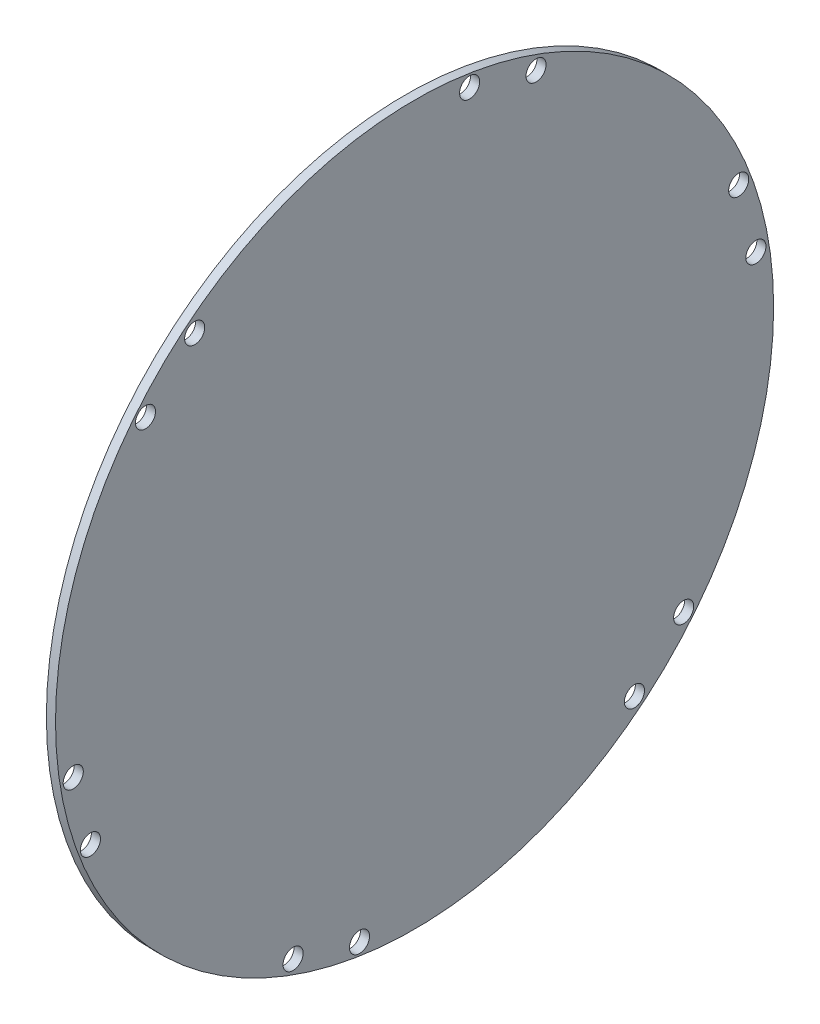
from build123d import *

# Parameters (mm, degrees)
SKETCH2_R           = 125
BOSS_EXTRUDE1_DEPTH = 3.18
SKETCH3_R           = 3.5
CUT_EXTRUDE1_DEPTH  = 177.80529517


with BuildPart() as part:
    # Sketch2 → Boss-Extrude1 (new body)
    with BuildSketch(Plane(origin=(0, 0, 0), x_dir=(0, 0, -1), z_dir=(1, 0, 0))):
        Circle(SKETCH2_R)
    extrude(amount=BOSS_EXTRUDE1_DEPTH)

    # Sketch3 → Cut-Extrude1 (cut, through all)
    with BuildSketch(Plane.ZY):
        with Locations((118.823199541, -19.776442882)):
            Circle(SKETCH3_R)
        with Locations((112.836053622, -43.017658077)):
            Circle(SKETCH3_R)
        with Locations((19.163642105, -119.227717938)):
            Circle(SKETCH3_R)
        with Locations((42.284697838, -112.792130803)):
            Circle(SKETCH3_R)
        with Locations((-76.538501703, -93.015687921)):
            Circle(SKETCH3_R)
        with Locations((-93.672411517, -76.210059861)):
            Circle(SKETCH3_R)
        with Locations((-112.836053622, 43.017658077)):
            Circle(SKETCH3_R)
        with Locations((-118.823199541, 19.776442882)):
            Circle(SKETCH3_R)
        with Locations((-42.284697838, 112.792130802)):
            Circle(SKETCH3_R)
        with Locations((-19.163642105, 119.227717938)):
            Circle(SKETCH3_R)
        with Locations((76.538501703, 93.015687921)):
            Circle(SKETCH3_R)
        with Locations((93.672411517, 76.210059861)):
            Circle(SKETCH3_R)
    extrude(amount=-CUT_EXTRUDE1_DEPTH, mode=Mode.SUBTRACT)


solid = part.part
